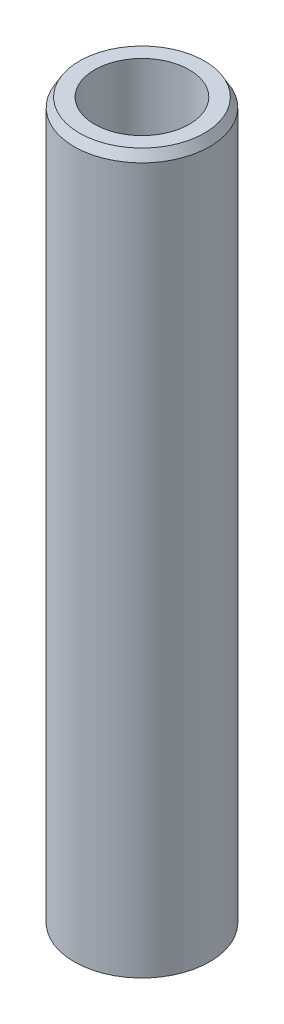
from build123d import *
from OCP.BRepFilletAPI import BRepFilletAPI_MakeChamfer

# Parameters (mm, degrees)
SKETCH1_R           = 37.5
BOSS_EXTRUDE1_DEPTH = 398.516272632
SKETCH2_R           = 26.16929748
CUT_EXTRUDE1_DEPTH  = 403.029500849
CHAMFER1_SIZE       = 5.045966888
CHAMFER1_SIZE2      = 2.913290341


with BuildPart() as part:
    # Sketch1 → Boss-Extrude1 (new body)
    with BuildSketch(Plane(origin=(0, 0, 0), x_dir=(1, 0, 0), z_dir=(0, 1, 0))):
        Circle(SKETCH1_R)
    extrude(amount=BOSS_EXTRUDE1_DEPTH)

    # Sketch2 → Cut-Extrude1 (cut, through all)
    with BuildSketch(Plane(origin=(0, 0, 0), x_dir=(1, 0, 0), z_dir=(0, 1, 0))):
        Circle(SKETCH2_R)
    extrude(amount=CUT_EXTRUDE1_DEPTH, mode=Mode.SUBTRACT)

    # Chamfer1: one chamfer whose edges measure the first distance from different faces: ONE call of the kernel's chamfer builder (chamfer() names one face for all edges)
    chamfer1_edges_1 = [part.edges().sort_by_distance(p)[0] for p in [
        (-37.5, 398.516272632, 0),
    ]]
    chamfer1_side_1 = [part.faces().sort_by_distance(p)[0] for p in [
        (-37.5, 199.258136316, 0),
    ]]
    chamfer1_edges_2 = [part.edges().sort_by_distance(p)[0] for p in [
        (-37.5, 0, 0),
    ]]
    chamfer1_side_2 = [part.faces().sort_by_distance(p)[0] for p in [
        (-36.439339828, 0, 0),
    ]]
    chamfer1 = BRepFilletAPI_MakeChamfer(part.part.solid().wrapped)
    for e in chamfer1_edges_1:
        chamfer1.Add(CHAMFER1_SIZE, CHAMFER1_SIZE2, e.wrapped, chamfer1_side_1[0].wrapped)  # the first distance lies on this face
    for e in chamfer1_edges_2:
        chamfer1.Add(CHAMFER1_SIZE, CHAMFER1_SIZE2, e.wrapped, chamfer1_side_2[0].wrapped)  # the first distance lies on this face
    add(Compound.cast(chamfer1.Shape()), mode=Mode.REPLACE)


solid = part.part
